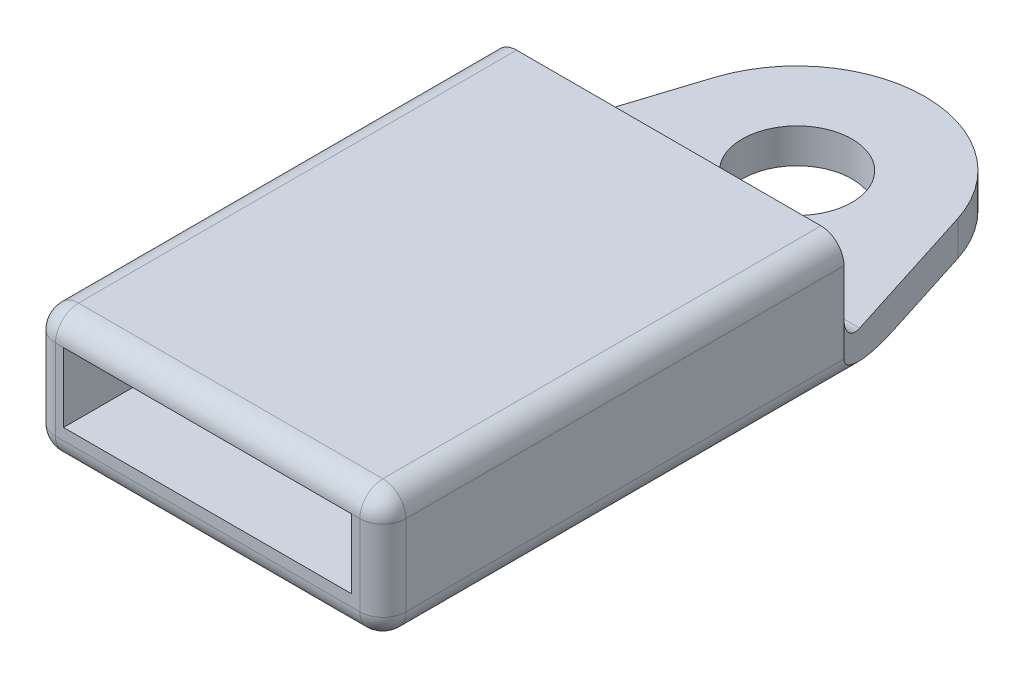
from build123d import *

# Parameters (mm, degrees)
SKETCH1_W               = 2.7
SKETCH1_H               = 40
BOSS_EXTRUDE2_DEPTH     = 11
BOSS_EXTRUDE2_2_DEPTH   = 11
SKETCH3_W               = 25
SKETCH3_H               = 40
BOSS_EXTRUDE3_DEPTH     = 3
BOSS_EXTRUDE4_REACH     = 51.883
SKETCH4_W               = 40
SKETCH4_H               = 2
SKETCH5_W               = 30.4
SKETCH5_H               = 3
BOSS_EXTRUDE5_DEPTH     = 22.225
CUT_EXTRUDE1_DEPTH      = 70.714493651
CUT_EXTRUDE1_DEPTH_BACK = 70.714493651
SKETCH7_R               = 4.7625
CUT_EXTRUDE2_DEPTH      = 70.714493651
FILLET6_R               = 2
FILLET8_R               = 2
FILLET9_R               = 2
FILLET10_R              = 2


with BuildPart() as part:
    # Sketch1 → Boss-Extrude2 (new body)
    with BuildSketch(Plane(origin=(0, 0, 0), x_dir=(1, 0, 0), z_dir=(0, 1, 0))):
        with Locations((-29.05, 20)):
            Rectangle(SKETCH1_W, SKETCH1_H)
    extrude(amount=BOSS_EXTRUDE2_DEPTH)



with BuildPart() as body_2:
    # Sketch1 → Boss-Extrude2 2 (new body)
    with BuildSketch(Plane(origin=(0, 0, 0), x_dir=(1, 0, 0), z_dir=(0, 1, 0))):
        with Locations((-1.35, 20)):
            Rectangle(SKETCH1_W, SKETCH1_H)
    extrude(amount=BOSS_EXTRUDE2_2_DEPTH)


with BuildPart() as part_1:
    add(part.part)

    add(body_2.part)  # Boss-Extrude3 merges body 2
    # Sketch3 → Boss-Extrude3 (add)
    with BuildSketch(Plane(origin=(0, 0, 0), x_dir=(1, 0, 0), z_dir=(0, 1, 0))):
        with Locations((-15.2, 20)):
            Rectangle(SKETCH3_W, SKETCH3_H)
    extrude(amount=BOSS_EXTRUDE3_DEPTH)

    # Sketch4 → Boss-Extrude4 (add, up to next)
    with BuildSketch(Plane(origin=(-27.7, 0, 0), x_dir=(0, 0, -1), z_dir=(1, 0, 0)), mode=Mode.PRIVATE) as boss_extrude4_sk1:
        with Locations((20, 10)):
            Rectangle(SKETCH4_W, SKETCH4_H)
    boss_extrude4_tool1 = extrude(boss_extrude4_sk1.sketch, amount=BOSS_EXTRUDE4_REACH, mode=Mode.PRIVATE) - part_1.part
    add(boss_extrude4_tool1.solids().sort_by_distance((-27.7, 10, -20))[0])

    # Sketch5 → Boss-Extrude5 (add)
    with BuildSketch(Plane(origin=(0, 0, -40), x_dir=(-1, 0, 0), z_dir=(0, 0, -1))):
        with Locations((15.2, 1.5)):
            Rectangle(SKETCH5_W, SKETCH5_H)
    extrude(amount=BOSS_EXTRUDE5_DEPTH)

    # Sketch6 → Cut-Extrude1 (cut, two sides: drawn at the far end of the back side and taken through both)
    with BuildSketch(Plane(origin=(0, 3, 0), x_dir=(1, 0, 0), z_dir=(0, 1, 0)).offset(-CUT_EXTRUDE1_DEPTH_BACK)):
        with BuildLine():
            Line((33.516714256, -65.275403725), (0, 40))
            Line((0, 40), (-4.611193503, 54.483676829))
            ThreePointArc((-4.611193503, 54.483676829), (-15.153412609, 62.224902344), (-25.760168287, 54.572341326))
            Line((-25.760168287, 54.572341326), (-30.4, 40))
            Line((-30.4, 40), (-63.919403204, -65.274547602))
            Line((-63.919403204, -65.274547602), (-63.917461702, 155.689528782))
            Line((-63.917461702, 155.689528782), (33.518655758, 155.688672658))
            Line((33.518655758, 155.688672658), (33.516714256, -65.275403725))
        make_face()
    extrude(amount=CUT_EXTRUDE1_DEPTH + CUT_EXTRUDE1_DEPTH_BACK, mode=Mode.SUBTRACT)

    # Sketch7 → Cut-Extrude2 (cut, through all)
    with BuildSketch(Plane(origin=(0, 3, 0), x_dir=(1, 0, 0), z_dir=(0, 1, 0))):
        with Locations(Location((-15.176706304, 51.112451172, 0), (0, 0, 270))):
            Circle(SKETCH7_R)
    extrude(amount=-CUT_EXTRUDE2_DEPTH, mode=Mode.SUBTRACT)

    # Fillet6
    fillet6_edges = [part_1.edges().sort_by_distance(p)[0] for p in [
        (-15.2, 11, 0),
    ]]
    fillet(fillet6_edges, radius=FILLET6_R - 0.0001)  # a hair under: the kernel refuses the full size

    # Fillet8
    fillet8_edges = [part_1.edges().sort_by_distance(p)[0] for p in [
        (0, 4.50005, 0),
        (0, 10.414242852, -0.585757148),
        (-30.4, 4.50005, 0),
        (-30.4, 10.414242852, -0.585757148),
        (0, 11, -20.99995),
        (-30.4, 11, -20.99995),
    ]]
    fillet(fillet8_edges, radius=FILLET8_R - 0.0001)  # a hair under: the kernel refuses the full size

    # Fillet9
    fillet9_edges = [part_1.edges().sort_by_distance(p)[0] for p in [
        (0, 0, -20.99995),
        (-0.585757148, 0, -0.585757148),
        (-15.2, 0, 0),
        (-29.814242852, 0, -0.585757148),
        (-30.4, 0, -20.99995),
    ]]
    fillet(fillet9_edges, radius=FILLET9_R - 0.0001)  # a hair under: the kernel refuses the full size

    # Fillet10
    fillet10_edges = [part_1.edges().sort_by_distance(p)[0] for p in [
        (-1.35, 3, -40),
        (-29.05, 3, -40),
    ]]
    fillet(fillet10_edges, radius=FILLET10_R)


solid = part_1.part
